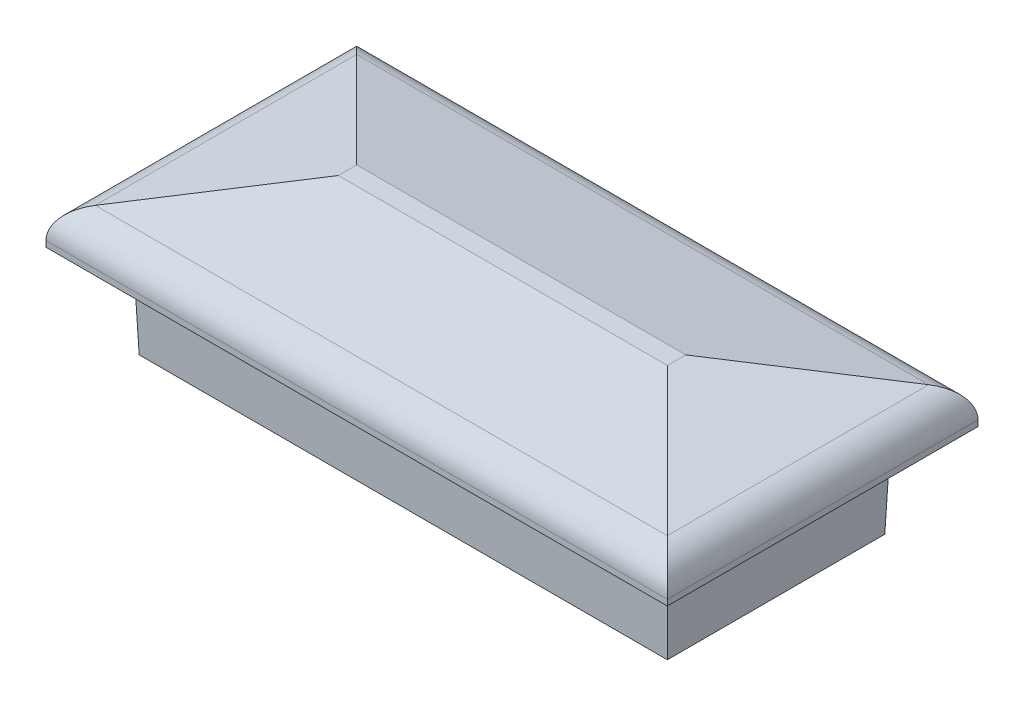
from build123d import *
from OCP.BRepFilletAPI import BRepFilletAPI_MakeChamfer

# Parameters (mm, degrees)
SKETCH1_W           = 43.942
SKETCH1_H           = 18.542
BOSS_EXTRUDE1_DEPTH = 7.62
CHAMFER1_SIZE       = 10.910412501
CHAMFER1_SIZE_2     = 0.381
SHELL1_T            = -2.54
SKETCH2_W           = 50.8
SKETCH2_H           = 25.4
BOSS_EXTRUDE2_DEPTH = 5.08
CHAMFER2_SIZE       = 2.54
CHAMFER2_SIZE2      = 11.949760478
FILLET1_R           = 2.54


with BuildPart() as part:
    # Sketch1 → Boss-Extrude1 (new body)
    with BuildSketch(Plane(origin=(0, 0, 0), x_dir=(1, 0, 0), z_dir=(0, 1, 0))):
        Rectangle(SKETCH1_W, SKETCH1_H)
    extrude(amount=BOSS_EXTRUDE1_DEPTH)

    # Chamfer1
    # the kernel refuses this chamfer: 10.910412501, 0.381 mm, written as the material it takes off along each edge
    with BuildSketch(Plane(origin=(-21.971, 0, 37.637433425), x_dir=(-0.0013423185755923317, 0.999999099090015, 0), z_dir=(0, 0, -1)), Plane(origin=(21.971, 0, -37.637433425), x_dir=(0.0013423185755923317, 0.999999099090015, 0), z_dir=(0, 0, 1))) as chamfer1_piece_1:
        Polygon((CHAMFER1_SIZE * 0.999999099071, CHAMFER1_SIZE * 0.00134231857557), (-CHAMFER1_SIZE_2 * 0.00134231857559, CHAMFER1_SIZE_2 * 0.99999909909), (0, 0), align=None)
    extrude(amount=75.27486685, mode=Mode.SUBTRACT)
    with BuildSketch(Plane(origin=(-50.337433425, 0, -9.271), x_dir=(0, 0.999999099090015, -0.0013423185755923317), z_dir=(1, 0, 0)), Plane(origin=(50.337433425, 0, 9.271), x_dir=(0, 0.999999099090015, 0.0013423185755923317), z_dir=(-1, 0, 0))) as chamfer1_piece_2:
        Polygon((CHAMFER1_SIZE * 0.999999099071, CHAMFER1_SIZE * 0.00134231857557), (-CHAMFER1_SIZE_2 * 0.00134231857559, CHAMFER1_SIZE_2 * 0.99999909909), (0, 0), align=None)
    extrude(amount=100.67486685, mode=Mode.SUBTRACT)

    # Shell1
    shell1_openings = [part.faces().sort_by_distance(p)[0] for p in [
        (0, 0, 0),
    ]]
    offset(amount=SHELL1_T, openings=shell1_openings, kind=Kind.INTERSECTION)

    # Sketch2 → Boss-Extrude2 (add)
    with BuildSketch(Plane(origin=(0, 7.62, 0), x_dir=(1, 0, 0), z_dir=(0, 1, 0))):
        Rectangle(SKETCH2_W, SKETCH2_H)
    extrude(amount=BOSS_EXTRUDE2_DEPTH)

    # Chamfer2: one chamfer whose edges measure the first distance from different faces: ONE call of the kernel's chamfer builder (chamfer() names one face for all edges)
    chamfer2_edges_1 = [part.edges().sort_by_distance(p)[0] for p in [
        (-25.4, 12.7, 0),
    ]]
    chamfer2_side_1 = [part.faces().sort_by_distance(p)[0] for p in [
        (-25.4, 10.16, 0),
    ]]
    chamfer2_edges_2 = [part.edges().sort_by_distance(p)[0] for p in [
        (0, 12.7, 12.7),
    ]]
    chamfer2_side_2 = [part.faces().sort_by_distance(p)[0] for p in [
        (0, 10.16, 12.7),
    ]]
    chamfer2_edges_3 = [part.edges().sort_by_distance(p)[0] for p in [
        (25.4, 12.7, 0),
    ]]
    chamfer2_side_3 = [part.faces().sort_by_distance(p)[0] for p in [
        (25.4, 10.16, 0),
    ]]
    chamfer2_edges_4 = [part.edges().sort_by_distance(p)[0] for p in [
        (0, 12.7, -12.7),
    ]]
    chamfer2_side_4 = [part.faces().sort_by_distance(p)[0] for p in [
        (0, 10.16, -12.7),
    ]]
    chamfer2 = BRepFilletAPI_MakeChamfer(part.part.solid().wrapped)
    for e in chamfer2_edges_1:
        chamfer2.Add(CHAMFER2_SIZE, CHAMFER2_SIZE2, e.wrapped, chamfer2_side_1[0].wrapped)  # the first distance lies on this face
    for e in chamfer2_edges_2:
        chamfer2.Add(CHAMFER2_SIZE, CHAMFER2_SIZE2, e.wrapped, chamfer2_side_2[0].wrapped)  # the first distance lies on this face
    for e in chamfer2_edges_3:
        chamfer2.Add(CHAMFER2_SIZE, CHAMFER2_SIZE2, e.wrapped, chamfer2_side_3[0].wrapped)  # the first distance lies on this face
    for e in chamfer2_edges_4:
        chamfer2.Add(CHAMFER2_SIZE, CHAMFER2_SIZE2, e.wrapped, chamfer2_side_4[0].wrapped)  # the first distance lies on this face
    add(Compound.cast(chamfer2.Shape()), mode=Mode.REPLACE)

    # Fillet1
    fillet1_edges = [part.edges().sort_by_distance(p)[0] for p in [
        (0, 10.16, 12.7),
        (-25.4, 10.16, 0),
        (0, 10.16, -12.7),
        (25.4, 10.16, 0),
    ]]
    fillet(fillet1_edges, radius=FILLET1_R)


solid = part.part
